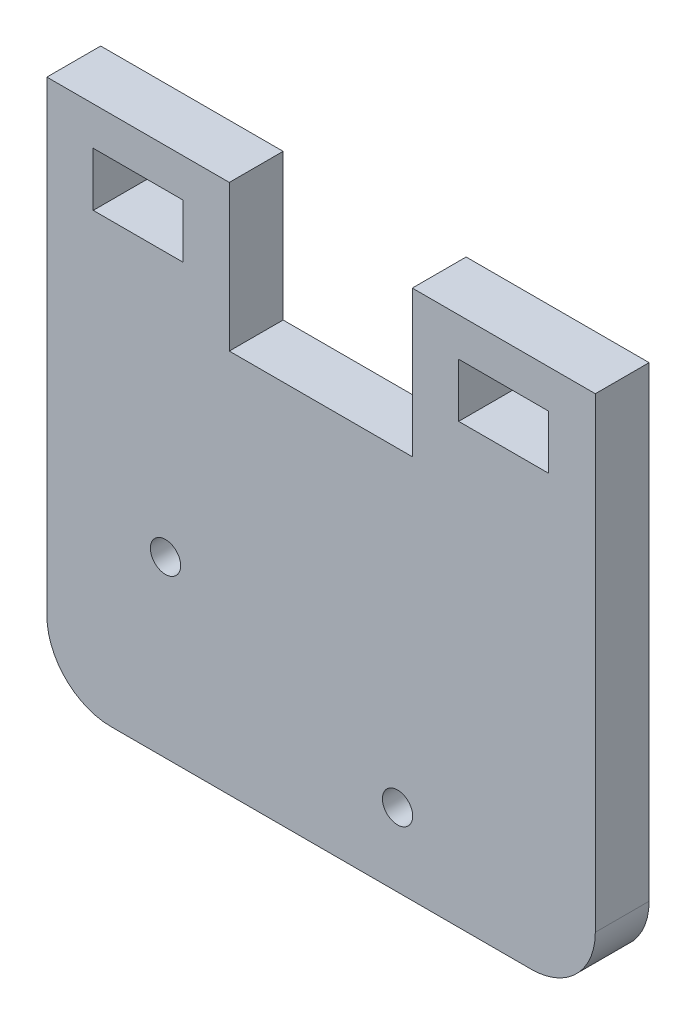
from build123d import *

# Parameters (mm, degrees)
SKETCH1_W           = 54.356
SKETCH1_H           = 43.434
BOSS_EXTRUDE1_DEPTH = 5.334
SKETCH2_W           = 18.137033298
SKETCH2_H           = 5.334
CUT_EXTRUDE1_DEPTH  = 41.016719041
FILLET1_R           = 6.35
SKETCH3_R           = 1.5
CUT_EXTRUDE3_DEPTH  = 41.016719041
SKETCH4_W           = 18.081933404
SKETCH4_H           = 5.334
SKETCH4_W_2         = 18.137033298
BOSS_EXTRUDE2_DEPTH = 9.144
SKETCH5_W           = 8.89
SKETCH5_H           = 5.334
CUT_EXTRUDE4_DEPTH  = 47.344795572


with BuildPart() as part:
    # Sketch1 → Boss-Extrude1 (new body)
    with BuildSketch(Plane.XY):
        with Locations((-3.35450847, 3.594107707)):
            Rectangle(SKETCH1_W, SKETCH1_H)
    extrude(amount=BOSS_EXTRUDE1_DEPTH)

    # Sketch2 → Cut-Extrude1 (cut, through all)
    with BuildSketch(Plane.XY.offset(5.334)):
        with Locations((-3.382058417, 22.644107707)):
            Rectangle(SKETCH2_W, SKETCH2_H)
    extrude(amount=-CUT_EXTRUDE1_DEPTH, mode=Mode.SUBTRACT)

    # Fillet1
    fillet1_edges = [part.edges().sort_by_distance(p)[0] for p in [
        (-30.53250847, -18.122892293, 2.667),
        (23.82349153, -18.122892293, 2.667),
    ]]
    fillet(fillet1_edges, radius=FILLET1_R)

    # Sketch3 → Cut-Extrude3 (cut, through all)
    with BuildSketch(Plane.XY.offset(5.334)):
        with Locations((-18.775410686, -0.856094215)):
            Circle(SKETCH3_R)
        with Locations((4.224589314, -10.856094215)):
            Circle(SKETCH3_R)
    extrude(amount=-CUT_EXTRUDE3_DEPTH, mode=Mode.SUBTRACT)

    # Sketch4 → Boss-Extrude2 (add)
    with BuildSketch(Plane(origin=(0, 25.311107707, 0), x_dir=(1, 0, 0), z_dir=(0, 1, 0))):
        with Locations((-21.491541768, -2.667)):
            Rectangle(SKETCH4_W, SKETCH4_H)
        with Locations((14.754974881, -2.667)):
            Rectangle(SKETCH4_W_2, SKETCH4_H)
    extrude(amount=BOSS_EXTRUDE2_DEPTH)

    # Sketch5 → Cut-Extrude4 (cut, through all)
    with BuildSketch(Plane.XY.offset(5.334)):
        with Locations((-21.491541768, 27.978107707)):
            Rectangle(SKETCH5_W, SKETCH5_H)
        with Locations((14.727424934, 27.978107707)):
            Rectangle(SKETCH5_W, SKETCH5_H)
    extrude(amount=-CUT_EXTRUDE4_DEPTH, mode=Mode.SUBTRACT)


solid = part.part
